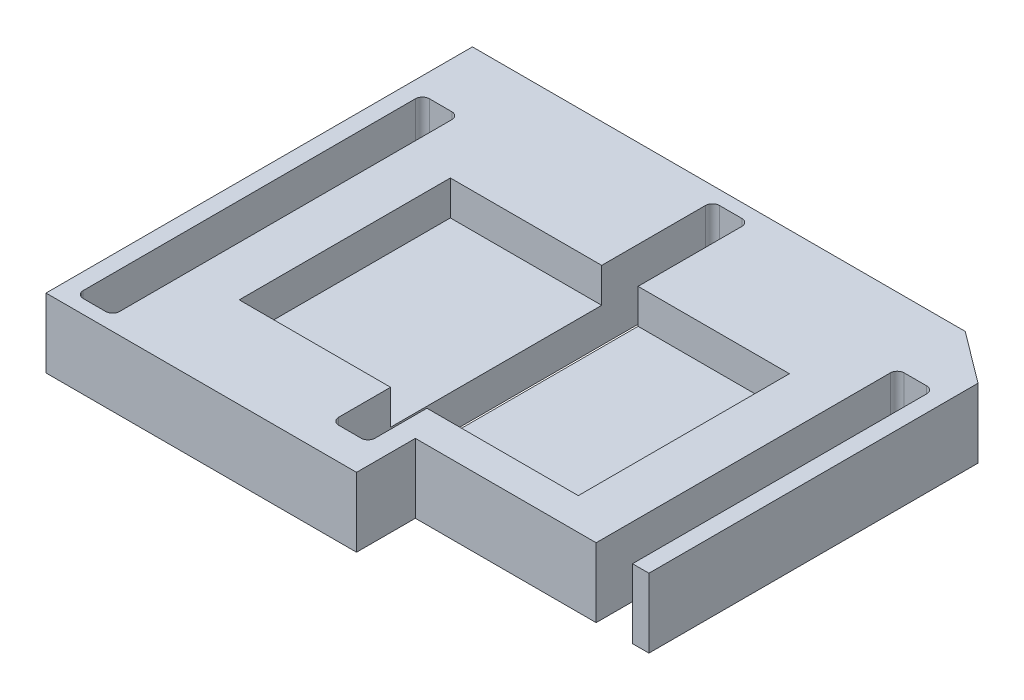
from build123d import *

# Parameters (mm, degrees)
BOSS_EXTRUDE1_DEPTH = 10
FILLET1_R           = 1
SKETCH2_W           = 21.86553483
SKETCH2_H           = 30.5
CUT_EXTRUDE1_DEPTH  = 5
MIRROR1_DEPTH       = 10
MIRROR1_2_OUTLINE_W = 21.86553483
MIRROR1_2_OUTLINE_H = 30.5
MIRROR1_2_DEPTH     = 5
SKETCH6_W           = 43.680332617
SKETCH6_H           = 16.249834628
CUT_EXTRUDE2_DEPTH  = 10


# Read off the part's stored shape, not the designer's step: Mirror1
with BuildPart() as part:
    # Sketch1 → Boss-Extrude1 (new body)
    with BuildSketch(Plane(origin=(0, 0, 0), x_dir=(1, 0, 0), z_dir=(0, 1, 0))):
        Polygon((-5, 57.097150921), (34.3, 57.097150921), (34.3, 55.097150921), (31.675, 55.097150921), (31.675, 52.597150921), (31.675, 2.599340873), (31.675, 0.099340873), (34.3, 0.099340873), (34.3, -4.5), (-5, -4.5), align=None)
        Polygon((-2.625, 45), (-2.625, 0), (-2.625, -2.5), (0, -2.5), (2.625, -2.5), (2.625, 0), (2.625, 45), (2.625, 47.5), (0, 47.5), (-2.625, 47.5), align=None, mode=Mode.SUBTRACT)
    extrude(amount=BOSS_EXTRUDE1_DEPTH)

    # Fillet1
    fillet1_edges = [part.edges().sort_by_distance(p)[0] for p in [
        (31.675, 5, -55.097150921),
        (31.675, 5, -0.099340873),
        (-2.625, 5, -47.5),
        (-2.625, 5, 2.5),
        (2.625, 5, 2.5),
        (2.625, 5, -47.5),
    ]]
    fillet(fillet1_edges, radius=FILLET1_R)

    # Sketch2 → Cut-Extrude1 (cut)
    with BuildSketch(Plane(origin=(0, 10, 0), x_dir=(1, 0, 0), z_dir=(0, 1, 0))):
        with Locations((20.742232585, 23.8519351)):
            Rectangle(SKETCH2_W, SKETCH2_H)
    extrude(amount=-CUT_EXTRUDE1_DEPTH, mode=Mode.SUBTRACT)

    # Mirror1 outline → Mirror1 (add)
    with BuildSketch(Plane(origin=(0, 0, 0), x_dir=(1, 0, 0), z_dir=(0, 1, 0))):
        with BuildLine():
            ThreePointArc((35.925, 55.097150921), (36.632106781, 54.804257702), (36.925, 54.097150921))
            Line((36.925, 54.097150921), (36.925, 39.1019351))
            Line((36.925, 39.1019351), (58.79053483, 39.1019351))
            Line((58.79053483, 39.1019351), (58.79053483, 8.6019351))
            Line((58.79053483, 8.6019351), (36.925, 8.6019351))
            Line((36.925, 8.6019351), (36.925, 1.099340873))
            ThreePointArc((36.925, 1.099340873), (36.632106781, 0.392234092), (35.925, 0.099340873))
            Line((35.925, 0.099340873), (34.3, 0.099340873))
            Line((34.3, 0.099340873), (34.3, -4.5))
            Line((34.3, -4.5), (73.6, -4.5))
            Line((73.6, -4.5), (73.6, 57.097150921))
            Line((73.6, 57.097150921), (34.3, 57.097150921))
            Line((34.3, 57.097150921), (34.3, 55.097150921))
            Line((34.3, 55.097150921), (35.925, 55.097150921))
        make_face()
        with BuildLine():
            Line((70.225, -2.5), (66.975, -2.5))
            ThreePointArc((66.975, -2.5), (66.267893219, -2.207106781), (65.975, -1.5))
            Line((65.975, -1.5), (65.975, 46.5))
            ThreePointArc((65.975, 46.5), (66.267893219, 47.207106781), (66.975, 47.5))
            Line((66.975, 47.5), (70.225, 47.5))
            ThreePointArc((70.225, 47.5), (70.932106781, 47.207106781), (71.225, 46.5))
            Line((71.225, 46.5), (71.225, -1.5))
            ThreePointArc((71.225, -1.5), (70.932106781, -2.207106781), (70.225, -2.5))
        make_face(mode=Mode.SUBTRACT)
    extrude(amount=MIRROR1_DEPTH)

    # Mirror1 2 outline → Mirror1 2 (add)
    with BuildSketch(Plane(origin=(0, 0, 0), x_dir=(1, 0, 0), z_dir=(0, 1, 0))):
        with Locations((47.857767415, 23.8519351)):
            Rectangle(MIRROR1_2_OUTLINE_W, MIRROR1_2_OUTLINE_H)
    extrude(amount=MIRROR1_2_DEPTH)

    # Sketch6 → Cut-Extrude2 (cut)
    with BuildSketch(Plane(origin=(0, 10, 0), x_dir=(1, 0, 0), z_dir=(0, 1, 0))):
        with Locations((61.699631479, -4.127511542)):
            Rectangle(SKETCH6_W, SKETCH6_H)
        Polygon((66.193799085, 57.097150921), (73.6, 51.534362723), (73.6, 57.097150921), align=None)
    extrude(amount=-CUT_EXTRUDE2_DEPTH, mode=Mode.SUBTRACT)


solid = part.part
